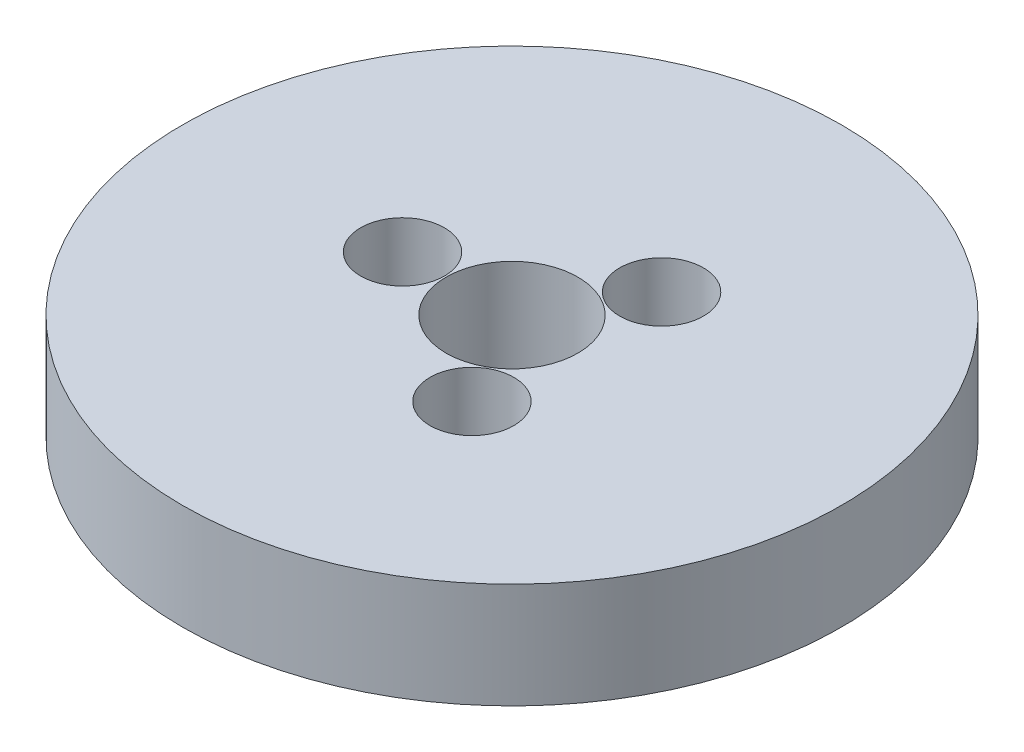
from build123d import *

# Parameters (mm, degrees)
SKETCH1_R           = 50
BOSS_EXTRUDE1_DEPTH = 16
SKETCH2_R           = 10
CUT_EXTRUDE1_DEPTH  = 73.498275842
SKETCH3_R           = 6.355381528
CUT_EXTRUDE2_DEPTH  = 11.22044528
CIRPATTERN1_COUNT   = 3


with BuildPart() as part:
    # Sketch1 → Boss-Extrude1 (new body)
    with BuildSketch(Plane(origin=(0, 0, 0), x_dir=(1, 0, 0), z_dir=(0, 1, 0))):
        Circle(SKETCH1_R)
    extrude(amount=BOSS_EXTRUDE1_DEPTH)

    # Sketch2 → Cut-Extrude1 (cut, through all)
    with BuildSketch(Plane(origin=(0, 0, 0), x_dir=(1, 0, 0), z_dir=(0, 1, 0))):
        Circle(SKETCH2_R)
    extrude(amount=CUT_EXTRUDE1_DEPTH, mode=Mode.SUBTRACT)

    # Sketch3 → Cut-Extrude2 (cut)
    with BuildSketch(Plane(origin=(0, 16, 0), x_dir=(1, 0, 0), z_dir=(0, 1, 0))):
        with Locations((-16.611671849, 0)):
            Circle(SKETCH3_R)
    cut_extrude2 = extrude(amount=-CUT_EXTRUDE2_DEPTH, mode=Mode.SUBTRACT)

    # CirPattern1: Cut-Extrude2 ×3 about axis
    cirpattern1_axis = Axis((0, 0, 0), (0, 1, 0))
    for i in range(1, CIRPATTERN1_COUNT):
        add(cut_extrude2.rotate(cirpattern1_axis, i * 360 / CIRPATTERN1_COUNT), mode=Mode.SUBTRACT)


solid = part.part
